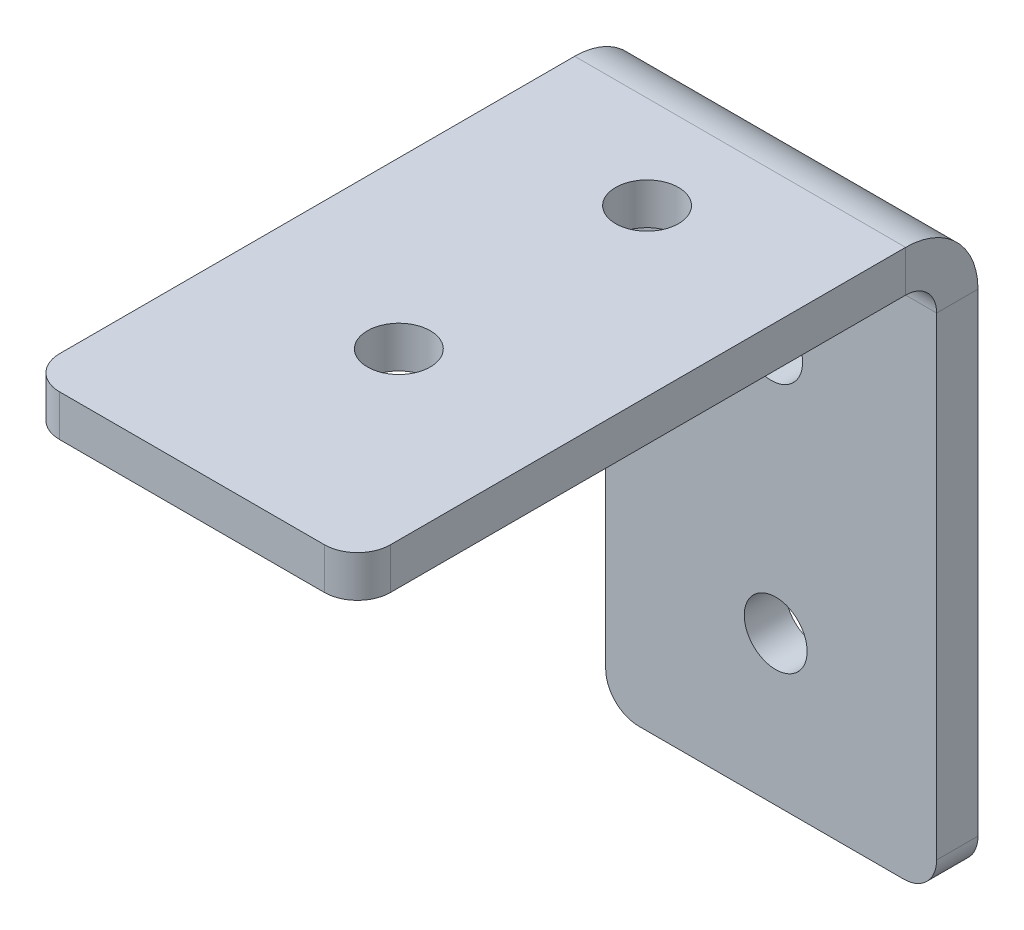
from build123d import *

# Parameters (mm, degrees)
SKETCH1_W              = 25.4
SKETCH1_H              = 44.45
SKETCH1_R              = 2.413
BOSS_EXTRUDE1_DEPTH    = 3.175
SKETCH2_W              = 25.4
SKETCH2_H              = 3.175
BOSS_EXTRUDE2_DEPTH    = 44.45
SKETCH3_R              = 2.413
CUT_EXTRUDE1_DEPTH     = 44.45
FILLET1_R              = 2.54
CONVERT_SOLID1_START   = -12.7
CONVERT_SOLID1_DEPTH   = 25.4
CONVERT_SOLID1_2_DEPTH = 25.4


# Read off the part's stored shape, not the designer's step: Convert-Solid1
with BuildPart() as part:
    # Sketch1 → Boss-Extrude1 (new body)
    with BuildSketch(Plane.XY):
        Rectangle(SKETCH1_W, SKETCH1_H)
        with Locations((0, 8.255)):
            Circle(SKETCH1_R, mode=Mode.SUBTRACT)
        with Locations((0.348627451, -10.795)):
            Circle(SKETCH1_R, mode=Mode.SUBTRACT)
    extrude(amount=BOSS_EXTRUDE1_DEPTH)

    # Sketch2 → Boss-Extrude2 (add)
    with BuildSketch(Plane.XY.offset(3.175)):
        with Locations((0, 20.6375)):
            Rectangle(SKETCH2_W, SKETCH2_H)
    extrude(amount=BOSS_EXTRUDE2_DEPTH)

    # Sketch3 → Cut-Extrude1 (cut)
    with BuildSketch(Plane(origin=(0, 22.225, 0), x_dir=(1, 0, 0), z_dir=(0, 1, 0))):
        with Locations(Location((0, -12.7, 0), (0, 0, 270))):
            Circle(SKETCH3_R)
        with Locations(Location((0, -31.75, 0), (0, 0, 270))):
            Circle(SKETCH3_R)
    extrude(amount=-CUT_EXTRUDE1_DEPTH, mode=Mode.SUBTRACT)

    # Fillet1
    fillet1_edges = [part.edges().sort_by_distance(p)[0] for p in [
        (-12.7, 20.6375, 47.625),
        (12.7, 20.6375, 47.625),
        (12.7, -22.225, 1.5875),
        (-12.7, -22.225, 1.5875),
    ]]
    fillet(fillet1_edges, radius=FILLET1_R)

    # Convert-Solid1 outline → Convert-Solid1 (cut)
    with BuildSketch(Plane.YZ.offset(CONVERT_SOLID1_START)):
        with BuildLine():
            Line((22.225, 0), (22.225, 5.555000066))
            ThreePointArc((22.225, 5.555000066), (20.59797815, 1.62702185), (16.669999934, 0))
            Line((16.669999934, 0), (22.225, 0))
        make_face()
    extrude(amount=CONVERT_SOLID1_DEPTH, mode=Mode.SUBTRACT)

    # Convert-Solid1 2 outline → Convert-Solid1 2 (add)
    with BuildSketch(Plane.YZ.offset(CONVERT_SOLID1_START)):
        with BuildLine():
            Line((19.05, 3.175), (19.05, 5.555000066))
            ThreePointArc((19.05, 5.555000066), (18.35291412, 3.87208588), (16.669999934, 3.175))
            Line((16.669999934, 3.175), (19.05, 3.175))
        make_face()
    extrude(amount=CONVERT_SOLID1_2_DEPTH)


solid = part.part
